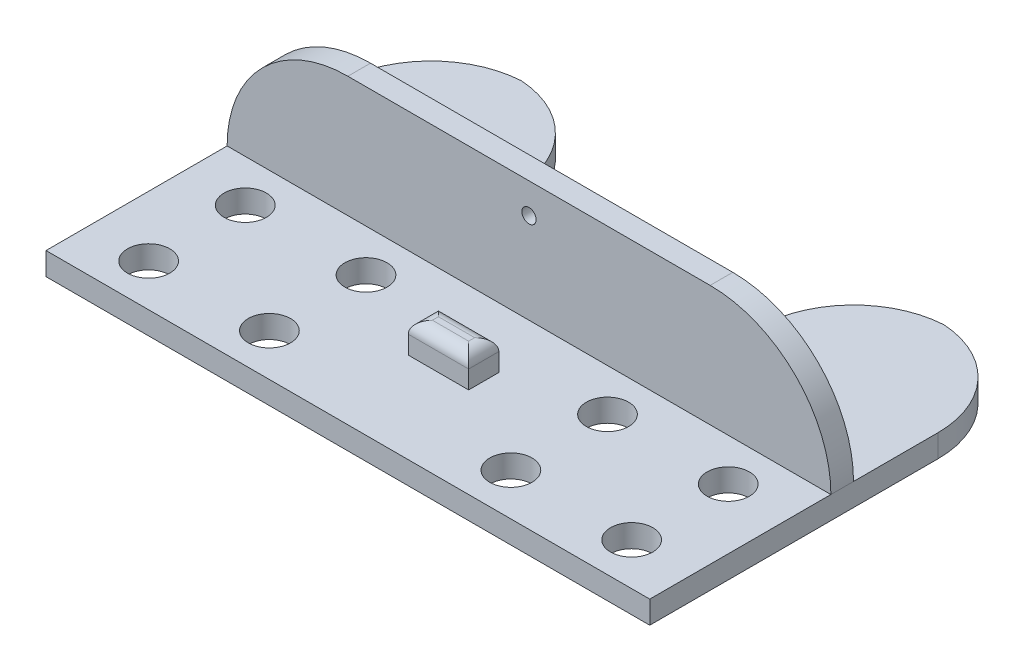
from build123d import *

# Parameters (mm, degrees)
SKETCH1_W           = 38.1
SKETCH1_H           = 4.7625
BOSS_EXTRUDE1_DEPTH = 127
SKETCH2_W           = 12.7
SKETCH2_H           = 6.35
BOSS_EXTRUDE2_DEPTH = 6.35
SKETCH3_R           = 1.499997
CUT_EXTRUDE1_DEPTH  = 138.389847924
FILLET1_R           = 2.54
SKETCH4_W           = 50.8
SKETCH4_H           = 38.1
CUT_EXTRUDE2_DEPTH  = 137.423436059
FILLET2_R           = 20.32
SKETCH5_R           = 4.445
CUT_EXTRUDE3_DEPTH  = 137.423436059
FILLET3_R           = 25.4


with BuildPart() as part:
    # Sketch1 → Boss-Extrude1 (new body)
    with BuildSketch(Plane(origin=(0, 0, 0), x_dir=(0, 0, -1), z_dir=(1, 0, 0))):
        Polygon((0, 30.1625), (0, 0), (-42.8625, 0), (-42.8625, 4.7625), (-4.7625, 4.7625), (-4.7625, 30.1625), align=None)
        with Locations((19.05, 2.38125)):
            Rectangle(SKETCH1_W, SKETCH1_H)
    extrude(amount=BOSS_EXTRUDE1_DEPTH)

    # Sketch2 → Boss-Extrude2 (add)
    with BuildSketch(Plane(origin=(0, 4.7625, 0), x_dir=(1, 0, 0), z_dir=(0, 1, 0))):
        with Locations((63.5, -20.6375)):
            Rectangle(SKETCH2_W, SKETCH2_H)
    extrude(amount=BOSS_EXTRUDE2_DEPTH)

    # Sketch3 → Cut-Extrude1 (cut, through all)
    with BuildSketch(Plane.XY.offset(4.7625)):
        with Locations((63.5, 23.8125)):
            Circle(SKETCH3_R)
    extrude(amount=-CUT_EXTRUDE1_DEPTH, mode=Mode.SUBTRACT)

    # Fillet1
    fillet1_edges = [part.edges().sort_by_distance(p)[0] for p in [
        (57.15, 11.1125, 20.6375),
        (63.5, 11.1125, 23.8125),
        (69.85, 11.1125, 20.6375),
        (63.5, 11.1125, 17.4625),
    ]]
    fillet(fillet1_edges, radius=FILLET1_R)

    # Sketch4 → Cut-Extrude2 (cut, through all)
    with BuildSketch(Plane(origin=(0, 4.7625, 0), x_dir=(1, 0, 0), z_dir=(0, 1, 0))):
        with Locations((63.5, 19.05)):
            Rectangle(SKETCH4_W, SKETCH4_H)
    extrude(amount=-CUT_EXTRUDE2_DEPTH, mode=Mode.SUBTRACT)

    # Fillet2
    # the kernel refuses this fillet: 20.32 mm, written as the material it takes off along each edge
    with BuildSketch(Plane(origin=(0, -50.8, -38.1), x_dir=(0, 0, 1), z_dir=(0, 1, 0)), Plane(origin=(88.9, 55.5625, -38.1), x_dir=(1, 0, 0), z_dir=(0, -1, 0))) as fillet2_piece_1:
        with BuildLine():
            CenterArc((FILLET2_R, FILLET2_R), FILLET2_R, 180, 90)
            Line((0, FILLET2_R), (0, 0))
            Line((0, 0), (FILLET2_R, 0))
        make_face()
    extrude(amount=106.3625, mode=Mode.SUBTRACT)
    with BuildSketch(Plane(origin=(38.1, 55.5625, -38.1), x_dir=(-1, 0, 0), z_dir=(0, -1, 0)), Plane(origin=(127, -50.8, -38.1), x_dir=(0, 0, 1), z_dir=(0, 1, 0))) as fillet2_piece_2:
        with BuildLine():
            CenterArc((FILLET2_R, -FILLET2_R), FILLET2_R, 90, 90)
            Line((0, -FILLET2_R), (0, 0))
            Line((0, 0), (FILLET2_R, 0))
        make_face()
    extrude(amount=106.3625, mode=Mode.SUBTRACT)

    # Sketch5 → Cut-Extrude3 (cut, through all)
    with BuildSketch(Plane(origin=(0, 4.7625, 0), x_dir=(1, 0, 0), z_dir=(0, 1, 0))):
        with Locations(Location((12.7, -13.6525, 0), (0, 0, 270))):
            Circle(SKETCH5_R)
        with Locations(Location((12.7, -33.9725, 0), (0, 0, 270))):
            Circle(SKETCH5_R)
        with Locations(Location((114.3, -13.6525, 0), (0, 0, 270))):
            Circle(SKETCH5_R)
        with Locations(Location((114.3, -33.9725, 0), (0, 0, 270))):
            Circle(SKETCH5_R)
        with Locations(Location((38.1, -13.6525, 0), (0, 0, 270))):
            Circle(SKETCH5_R)
        with Locations(Location((88.9, -13.6525, 0), (0, 0, 270))):
            Circle(SKETCH5_R)
        with Locations(Location((38.1, -33.9725, 0), (0, 0, 270))):
            Circle(SKETCH5_R)
        with Locations(Location((88.9, -33.9725, 0), (0, 0, 270))):
            Circle(SKETCH5_R)
    extrude(amount=-CUT_EXTRUDE3_DEPTH, mode=Mode.SUBTRACT)

    # Fillet3
    fillet3_edges = [part.edges().sort_by_distance(p)[0] for p in [
        (127, 30.1625, 2.38125),
        (0, 30.1625, 2.38125),
    ]]
    fillet(fillet3_edges, radius=FILLET3_R)


solid = part.part
